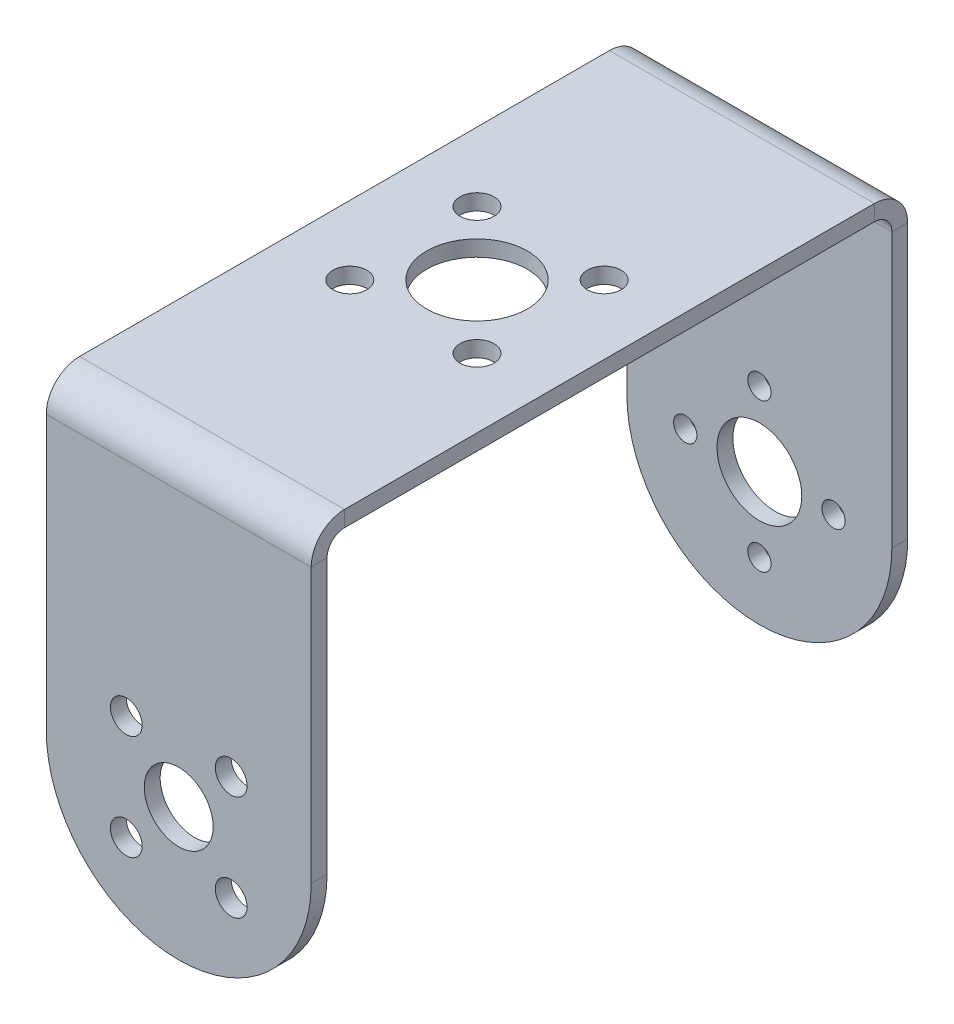
from build123d import *

# Parameters (mm, degrees)
SKETCH1_W                      = 25
SKETCH1_H                      = 53.3
BASE_FLANGE1_DEPTH             = 1.5
EDGE_FLANGE1_STRIP_W           = 9.3
EDGE_FLANGE1_STRIP_H           = 1.5
EDGE_FLANGE1_STRIP_CUT_DEPTH   = 25
EDGE_FLANGE1_STRIP_2_W         = 9.3
EDGE_FLANGE1_STRIP_2_H         = 1.5
EDGE_FLANGE1_STRIP_CUT_2_DEPTH = 25
EDGE_FLANGE1_DEPTH             = 25
EDGE_FLANGE1_BEND_DEPTH        = 25
CUT_EXTRUDE1_REACH             = 73.051
SKETCH12_R                     = 1.5
SKETCH12_R_2                   = 3.25
CUT_EXTRUDE2_REACH             = 73.051
SKETCH13_R                     = 4
SKETCH13_R_2                   = 1.1
FILLET1_R                      = 12.5
SKETCH17_R                     = 1.6
SKETCH17_R_2                   = 4.75
CUT_EXTRUDE3_DEPTH             = 52.680968451


# Sheet-metal steps are written as plain solids
with BuildPart() as part:
    # Base-Flange1: sheet metal written as solids
    # Sketch1 → Base-Flange1 (new body)
    with BuildSketch(Plane(origin=(0, 0, 0), x_dir=(1, 0, 0), z_dir=(0, 1, 0))):
        Rectangle(SKETCH1_W, SKETCH1_H)
    extrude(amount=-BASE_FLANGE1_DEPTH)

    # Edge-Flange1: sheet metal written as solids
    # Edge-Flange1 strip (on a plane across the edge) → Edge-Flange1 strip cut (cut)
    with BuildSketch(Plane(origin=(12.5, -1.5, 26.65), x_dir=(0, 0, -1), z_dir=(-1, 0, 0))):
        with Locations((-3, -0.75)):
            Rectangle(EDGE_FLANGE1_STRIP_W, EDGE_FLANGE1_STRIP_H)
    extrude(amount=EDGE_FLANGE1_STRIP_CUT_DEPTH, mode=Mode.SUBTRACT)

    # Edge-Flange1 strip 2 (on a plane across the edge) → Edge-Flange1 strip cut 2 (cut)
    with BuildSketch(Plane(origin=(-12.5, -1.5, -26.65), x_dir=(0, 0, 1), z_dir=(1, 0, 0))):
        with Locations((-3, -0.75)):
            Rectangle(EDGE_FLANGE1_STRIP_2_W, EDGE_FLANGE1_STRIP_2_H)
    extrude(amount=EDGE_FLANGE1_STRIP_CUT_2_DEPTH, mode=Mode.SUBTRACT)

    # Edge-Flange1 section (on a plane across the edge) → Edge-Flange1 (add)
    with BuildSketch(Plane(origin=(12.5, -1.5, 26.65), x_dir=(0, 0, -1), z_dir=(-1, 0, 0))):
        with BuildLine():
            Line((-1.5, 1.65), (-1.5, 40))
            Line((-1.5, 40), (0, 40))
            Line((0, 40), (0, 1.65))
            ThreePointArc((0, 1.65), (0.483273811, 0.483273811), (1.65, 0))
            Line((1.65, 0), (1.65, -1.5))
            ThreePointArc((1.65, -1.5), (-0.577386361, -0.577386361), (-1.5, 1.65))
        make_face()
    extrude(amount=EDGE_FLANGE1_DEPTH)

    # Edge-Flange1 section 2 (on a plane across the edge) → Edge-Flange1 bend (add)
    with BuildSketch(Plane(origin=(-12.5, -1.5, -26.65), x_dir=(0, 0, 1), z_dir=(1, 0, 0))):
        with BuildLine():
            Line((-1.5, 1.65), (-1.5, 40))
            Line((-1.5, 40), (0, 40))
            Line((0, 40), (0, 1.65))
            ThreePointArc((0, 1.65), (0.483273811, 0.483273811), (1.65, 0))
            Line((1.65, 0), (1.65, -1.5))
            ThreePointArc((1.65, -1.5), (-0.577386361, -0.577386361), (-1.5, 1.65))
        make_face()
    extrude(amount=EDGE_FLANGE1_BEND_DEPTH)

    # Sketch12 → Cut-Extrude1 (cut, up to next)
    with BuildSketch(Plane.XY.offset(28.15), mode=Mode.PRIVATE) as cut_extrude1_sk1:
        with Locations((-4.949747468, -24.050252532)):
            Circle(SKETCH12_R)
    cut_extrude1_tool1 = extrude(cut_extrude1_sk1.sketch, amount=-CUT_EXTRUDE1_REACH, mode=Mode.PRIVATE) & part.part
    # Sketch12 → Cut-Extrude1 (cut, up to next)
    with BuildSketch(Plane.XY.offset(28.15), mode=Mode.PRIVATE) as cut_extrude1_sk2:
        with Locations((4.949747468, -24.050252532)):
            Circle(SKETCH12_R)
    cut_extrude1_tool2 = extrude(cut_extrude1_sk2.sketch, amount=-CUT_EXTRUDE1_REACH, mode=Mode.PRIVATE) & part.part
    # Sketch12 → Cut-Extrude1 (cut, up to next)
    with BuildSketch(Plane.XY.offset(28.15), mode=Mode.PRIVATE) as cut_extrude1_sk3:
        with Locations((-4.949747468, -33.949747468)):
            Circle(SKETCH12_R)
    cut_extrude1_tool3 = extrude(cut_extrude1_sk3.sketch, amount=-CUT_EXTRUDE1_REACH, mode=Mode.PRIVATE) & part.part
    # Sketch12 → Cut-Extrude1 (cut, up to next)
    with BuildSketch(Plane.XY.offset(28.15), mode=Mode.PRIVATE) as cut_extrude1_sk4:
        with Locations((4.949747468, -33.949747468)):
            Circle(SKETCH12_R)
    cut_extrude1_tool4 = extrude(cut_extrude1_sk4.sketch, amount=-CUT_EXTRUDE1_REACH, mode=Mode.PRIVATE) & part.part
    # Sketch12 → Cut-Extrude1 (cut, up to next)
    with BuildSketch(Plane.XY.offset(28.15), mode=Mode.PRIVATE) as cut_extrude1_sk5:
        with Locations((0, -29)):
            Circle(SKETCH12_R_2)
    cut_extrude1_tool5 = extrude(cut_extrude1_sk5.sketch, amount=-CUT_EXTRUDE1_REACH, mode=Mode.PRIVATE) & part.part
    add(cut_extrude1_tool1.solids().sort_by_distance((-4.949747, -24.050253, 28.15))[0], mode=Mode.SUBTRACT)
    add(cut_extrude1_tool2.solids().sort_by_distance((4.949747, -24.050253, 28.15))[0], mode=Mode.SUBTRACT)
    add(cut_extrude1_tool3.solids().sort_by_distance((-4.949747, -33.949747, 28.15))[0], mode=Mode.SUBTRACT)
    add(cut_extrude1_tool4.solids().sort_by_distance((4.949747, -33.949747, 28.15))[0], mode=Mode.SUBTRACT)
    add(cut_extrude1_tool5.solids().sort_by_distance((0, -29, 28.15))[0], mode=Mode.SUBTRACT)

    # Sketch13 → Cut-Extrude2 (cut, up to next)
    with BuildSketch(Plane(origin=(0, 0, -28.15), x_dir=(-1, 0, 0), z_dir=(0, 0, -1)), mode=Mode.PRIVATE) as cut_extrude2_sk1:
        with Locations(Location((0, -29, 0), (0, 0, 90))):
            Circle(SKETCH13_R)
    cut_extrude2_tool1 = extrude(cut_extrude2_sk1.sketch, amount=-CUT_EXTRUDE2_REACH, mode=Mode.PRIVATE) & part.part
    # Sketch13 → Cut-Extrude2 (cut, up to next)
    with BuildSketch(Plane(origin=(0, 0, -28.15), x_dir=(-1, 0, 0), z_dir=(0, 0, -1)), mode=Mode.PRIVATE) as cut_extrude2_sk2:
        with Locations(Location((0, -36, 0), (0, 0, 90))):
            Circle(SKETCH13_R_2)
    cut_extrude2_tool2 = extrude(cut_extrude2_sk2.sketch, amount=-CUT_EXTRUDE2_REACH, mode=Mode.PRIVATE) & part.part
    # Sketch13 → Cut-Extrude2 (cut, up to next)
    with BuildSketch(Plane(origin=(0, 0, -28.15), x_dir=(-1, 0, 0), z_dir=(0, 0, -1)), mode=Mode.PRIVATE) as cut_extrude2_sk3:
        with Locations(Location((-7, -29, 0), (0, 0, 90))):
            Circle(SKETCH13_R_2)
    cut_extrude2_tool3 = extrude(cut_extrude2_sk3.sketch, amount=-CUT_EXTRUDE2_REACH, mode=Mode.PRIVATE) & part.part
    # Sketch13 → Cut-Extrude2 (cut, up to next)
    with BuildSketch(Plane(origin=(0, 0, -28.15), x_dir=(-1, 0, 0), z_dir=(0, 0, -1)), mode=Mode.PRIVATE) as cut_extrude2_sk4:
        with Locations(Location((0, -22, 0), (0, 0, 90))):
            Circle(SKETCH13_R_2)
    cut_extrude2_tool4 = extrude(cut_extrude2_sk4.sketch, amount=-CUT_EXTRUDE2_REACH, mode=Mode.PRIVATE) & part.part
    # Sketch13 → Cut-Extrude2 (cut, up to next)
    with BuildSketch(Plane(origin=(0, 0, -28.15), x_dir=(-1, 0, 0), z_dir=(0, 0, -1)), mode=Mode.PRIVATE) as cut_extrude2_sk5:
        with Locations(Location((7, -29, 0), (0, 0, 90))):
            Circle(SKETCH13_R_2)
    cut_extrude2_tool5 = extrude(cut_extrude2_sk5.sketch, amount=-CUT_EXTRUDE2_REACH, mode=Mode.PRIVATE) & part.part
    add(cut_extrude2_tool1.solids().sort_by_distance((0, -29, -28.15))[0], mode=Mode.SUBTRACT)
    add(cut_extrude2_tool2.solids().sort_by_distance((0, -36, -28.15))[0], mode=Mode.SUBTRACT)
    add(cut_extrude2_tool3.solids().sort_by_distance((7, -29, -28.15))[0], mode=Mode.SUBTRACT)
    add(cut_extrude2_tool4.solids().sort_by_distance((0, -22, -28.15))[0], mode=Mode.SUBTRACT)
    add(cut_extrude2_tool5.solids().sort_by_distance((-7, -29, -28.15))[0], mode=Mode.SUBTRACT)

    # Fillet1
    fillet1_edges = [part.edges().sort_by_distance(p)[0] for p in [
        (12.5, -41.5, 27.4),
        (-12.5, -41.5, 27.4),
        (-12.5, -41.5, -27.4),
        (12.5, -41.5, -27.4),
    ]]
    fillet(fillet1_edges, radius=FILLET1_R - 0.0001)  # a hair under: the kernel refuses the full size

    # Sketch17 → Cut-Extrude3 (cut, through all)
    with BuildSketch(Plane(origin=(0, 0, 0), x_dir=(1, 0, 0), z_dir=(0, 1, 0))):
        with Locations(Location((-6, 6, 0), (0, 0, 270))):
            Circle(SKETCH17_R)
        with Locations(Location((6, 6, 0), (0, 0, 270))):
            Circle(SKETCH17_R)
        with Locations(Location((6, -6, 0), (0, 0, 270))):
            Circle(SKETCH17_R)
        with Locations(Location((-6, -6, 0), (0, 0, 270))):
            Circle(SKETCH17_R)
        with Locations(Location((0, 0, 0), (0, 0, 270))):
            Circle(SKETCH17_R_2)
    extrude(amount=-CUT_EXTRUDE3_DEPTH, mode=Mode.SUBTRACT)


solid = part.part
